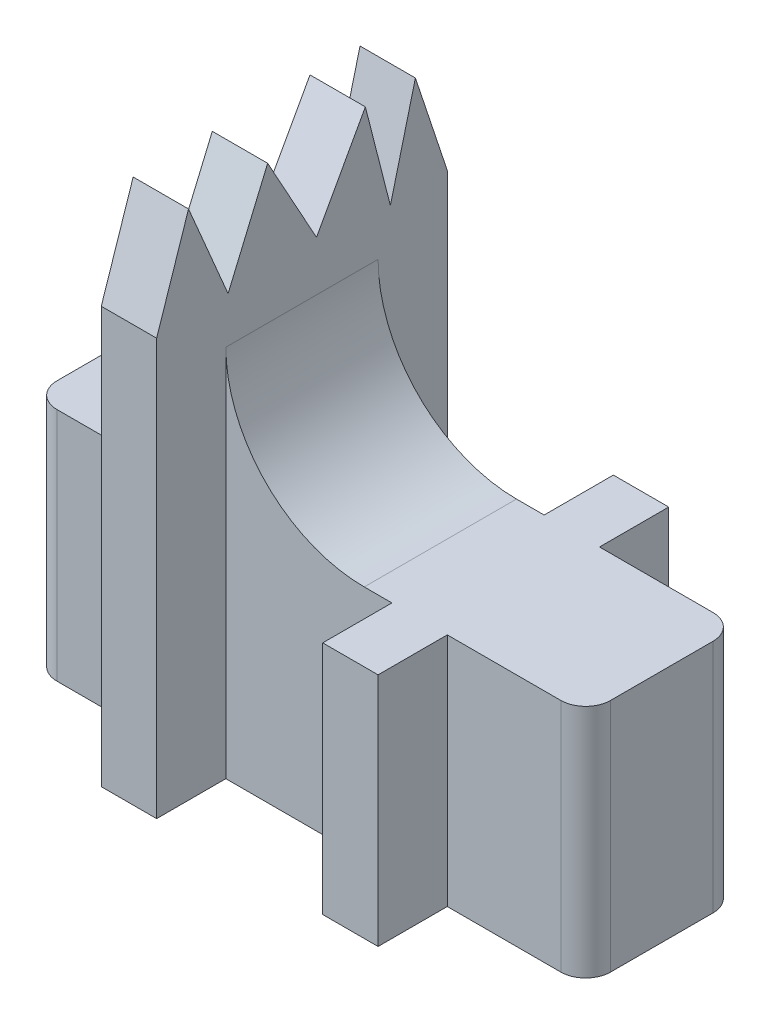
from build123d import *

# Parameters (mm, degrees)
BOSS_EXTRUDE1_DEPTH = 8.5
FILLET1_R           = 0.9
SKETCH2_W           = 2
SKETCH2_H           = 10.5
BOSS_EXTRUDE2_DEPTH = 10
CUT_EXTRUDE1_DEPTH  = 25.388778157
FILLET2_R           = 5


with BuildPart() as part:
    # Sketch1 → Boss-Extrude1 (new body)
    with BuildSketch(Plane(origin=(0, 0, 0), x_dir=(1, 0, 0), z_dir=(0, 1, 0))):
        Polygon((-10, 2.75), (-10, -2.75), (-5, -2.75), (-5, -5.25), (-3, -5.25), (-3, -2.75), (3, -2.75), (3, -5.25), (5, -5.25), (5, -2.75), (10, -2.75), (10, 2.75), (5, 2.75), (5, 5.25), (3, 5.25), (3, 2.75), (-3, 2.75), (-3, 5.25), (-5, 5.25), (-5, 2.75), align=None)
    extrude(amount=BOSS_EXTRUDE1_DEPTH)

    # Fillet1
    fillet1_edges = [part.edges().sort_by_distance(p)[0] for p in [
        (10, 4.25, -2.75),
        (10, 4.25, 2.75),
        (-10, 4.25, 2.75),
        (-10, 4.25, -2.75),
    ]]
    fillet(fillet1_edges, radius=FILLET1_R)

    # Sketch2 → Boss-Extrude2 (add)
    with BuildSketch(Plane(origin=(0, 8.5, 0), x_dir=(1, 0, 0), z_dir=(0, 1, 0))):
        with Locations((-4, 0)):
            Rectangle(SKETCH2_W, SKETCH2_H)
    extrude(amount=BOSS_EXTRUDE2_DEPTH)

    # Sketch3 → Cut-Extrude1 (cut, through all)
    with BuildSketch(Plane.ZY.offset(5)):
        Polygon((-5.25, 18.5), (-5.25, 15.031688137), (-4.097886003, 18.5), align=None)
        Polygon((5.25, 18.5), (4.097886003, 18.5), (5.25, 15.031688137), align=None)
        Polygon((4.097886003, 18.5), (1.239330912, 18.5), (2.668608457, 15.136412698), align=None)
        Polygon((1.239330912, 18.5), (-2.290692588, 18.5), (-0.525680838, 15.299798855), align=None)
        Polygon((-2.290692588, 18.5), (-4.097886003, 18.5), (-3.194289296, 14.958804321), align=None)
    extrude(amount=-CUT_EXTRUDE1_DEPTH, mode=Mode.SUBTRACT)

    # Fillet2
    fillet2_edges = [part.edges().sort_by_distance(p)[0] for p in [
        (-3, 8.5, 0),
    ]]
    fillet(fillet2_edges, radius=FILLET2_R)


solid = part.part
